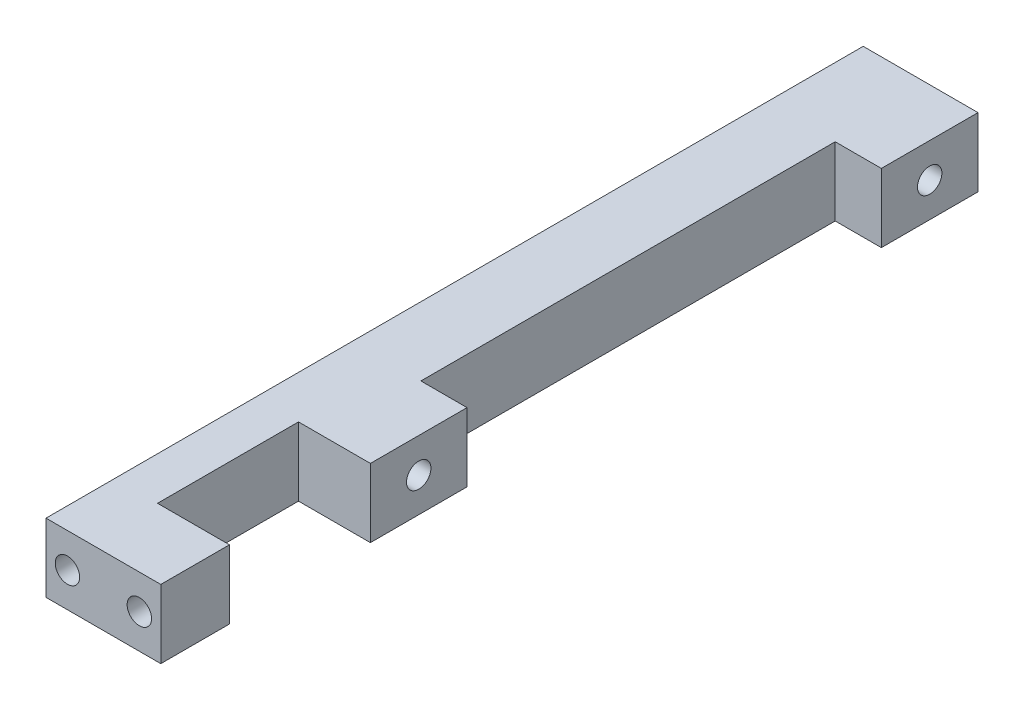
from build123d import *

# Parameters (mm, degrees)
SKETCH1_W                 = 10.62
SKETCH1_H                 = 75.6012
BOSS_EXTRUDE1_DEPTH       = 6.35
F_4_40_TAPPED_HOLE1_D     = 2.2606
F_4_40_TAPPED_HOLE1_DEPTH = 6.35
F_4_40_TAPPED_HOLE1_TIP   = 0.679152758
SKETCH2_W                 = 4.27
SKETCH2_H                 = 38.3286
SKETCH2_W_2               = 6.65125
SKETCH2_H_2               = 13.041
CUT_EXTRUDE1_DEPTH        = 39.696304221
F_4_40_TAPPED_HOLE2_D     = 2.2606
F_4_40_TAPPED_HOLE2_DEPTH = 7.62
F_4_40_TAPPED_HOLE2_TIP   = 0.679152758


with BuildPart() as part:
    # Sketch1 → Boss-Extrude1 (new body)
    with BuildSketch(Plane(origin=(0, 0, 0), x_dir=(1, 0, 0), z_dir=(0, 1, 0))):
        Rectangle(SKETCH1_W, SKETCH1_H)
    extrude(amount=BOSS_EXTRUDE1_DEPTH)

    # #4-40 Tapped Hole1
    with Locations(Plane(origin=(5.31, 0, 0), x_dir=(0, 0, -1), z_dir=(1, 0, 0))):
        with Locations((33.3302, 3.175), (-13.9392, 3.175)):
            Hole(F_4_40_TAPPED_HOLE1_D / 2, depth=F_4_40_TAPPED_HOLE1_DEPTH)
            with Locations((0, 0, -(F_4_40_TAPPED_HOLE1_DEPTH + F_4_40_TAPPED_HOLE1_TIP / 2))):  # 118° drill point
                Cone(0, F_4_40_TAPPED_HOLE1_D / 2, F_4_40_TAPPED_HOLE1_TIP, mode=Mode.SUBTRACT)

    # Sketch2 → Cut-Extrude1 (cut, through all)
    with BuildSketch(Plane(origin=(0, 6.35, 0), x_dir=(1, 0, 0), z_dir=(0, 1, 0))):
        with Locations((3.175, 9.6955)):
            Rectangle(SKETCH2_W, SKETCH2_H)
        with Locations((1.984375, -24.9301)):
            Rectangle(SKETCH2_W_2, SKETCH2_H_2)
    extrude(amount=-CUT_EXTRUDE1_DEPTH, mode=Mode.SUBTRACT)

    # #4-40 Tapped Hole2
    with Locations(Plane.XY.offset(37.8006)):
        with Locations((-3.325625, 3.175), (3.325625, 3.175)):
            Hole(F_4_40_TAPPED_HOLE2_D / 2, depth=F_4_40_TAPPED_HOLE2_DEPTH)
            with Locations((0, 0, -(F_4_40_TAPPED_HOLE2_DEPTH + F_4_40_TAPPED_HOLE2_TIP / 2))):  # 118° drill point
                Cone(0, F_4_40_TAPPED_HOLE2_D / 2, F_4_40_TAPPED_HOLE2_TIP, mode=Mode.SUBTRACT)


solid = part.part
